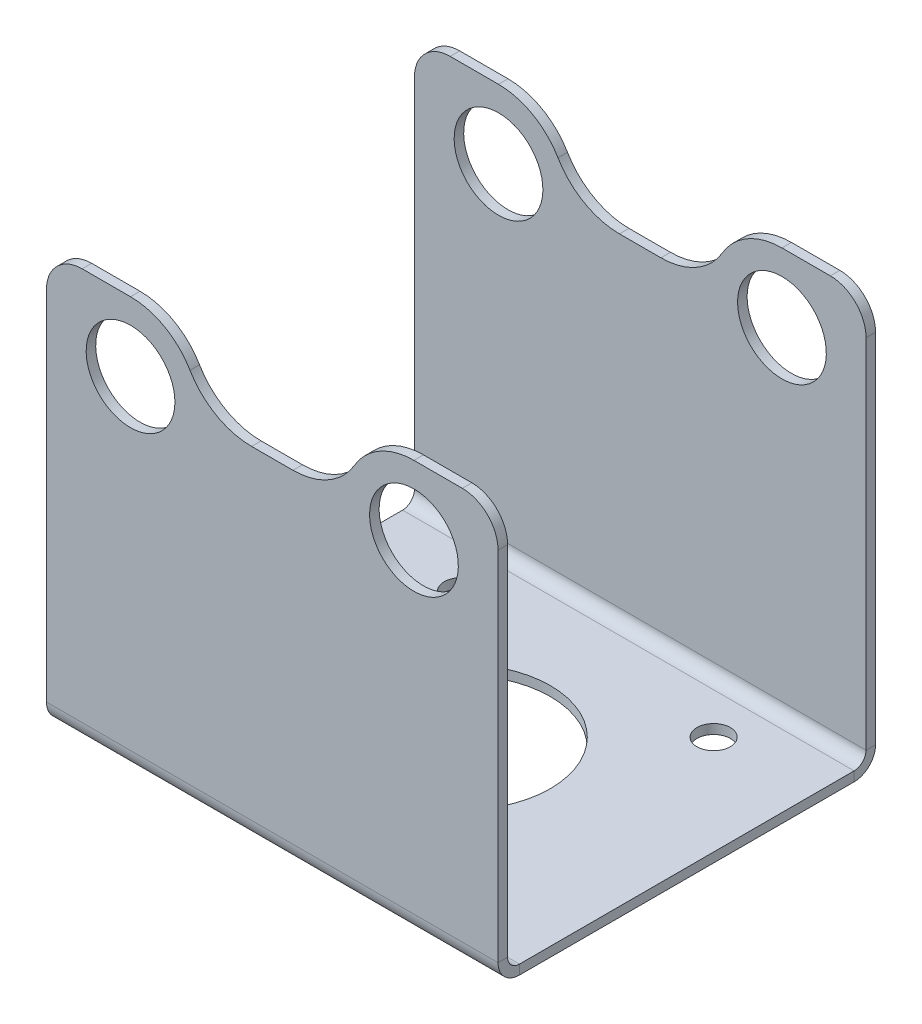
from build123d import *

# Parameters (mm, degrees)
SKETCH1_W                    = 48.1584
SKETCH1_H                    = 38.227
SKETCH1_R                    = 9.525
SKETCH1_R_2                  = 1.778
BASE_FLANGE1_DEPTH           = 1.016
EDGE_FLANGE1_STRIP_W         = 6.604
EDGE_FLANGE1_STRIP_H         = 1.016
EDGE_FLANGE1_STRIP_CUT_DEPTH = 48.1584
EDGE_FLANGE1_DEPTH           = 48.1584
EDGE_FLANGE1_START           = 1.016
EDGE_FLANGE1_PROFILE_W       = 48.1584
EDGE_FLANGE1_PROFILE_H       = 43.5102
EDGE_FLANGE1_PROFILE_R       = 4.73075
EDGE_FLANGE1_FLAT_DEPTH      = 1.016
CUT_EXTRUDE7_DEPTH           = 65.852611865
FILLET2_R                    = 7.62
FILLET3_R                    = 3.81


# Sheet-metal steps are written as plain solids
with BuildPart() as part:
    # Sketch1 → Base-Flange1 (new body)
    with BuildSketch(Plane(origin=(0, 0, 0), x_dir=(1, 0, 0), z_dir=(0, 1, 0))):
        Rectangle(SKETCH1_W, SKETCH1_H)
        with Locations(Location((0, 0, 0), (0, 0, 270))):
            Circle(SKETCH1_R, mode=Mode.SUBTRACT)
        with Locations(Location((13.470384182, -13.470384182, 0), (0, 0, 270))):
            Circle(SKETCH1_R_2, mode=Mode.SUBTRACT)
        with Locations(Location((13.470384182, 13.470384182, 0), (0, 0, 270))):
            Circle(SKETCH1_R_2, mode=Mode.SUBTRACT)
        with Locations(Location((-13.470384182, 13.470384182, 0), (0, 0, 90))):
            Circle(SKETCH1_R_2, mode=Mode.SUBTRACT)
        with Locations(Location((-13.470384182, -13.470384182, 0), (0, 0, 90))):
            Circle(SKETCH1_R_2, mode=Mode.SUBTRACT)
    extrude(amount=-BASE_FLANGE1_DEPTH)

    # Edge-Flange1 strip (across the edge) → Edge-Flange1 strip cut (cut)
    with BuildSketch(Plane(origin=(24.0792, 0, -19.1135), x_dir=(0, 0, 1), z_dir=(-1, 0, 0))):
        with Locations((-2.032, -0.508)):
            Rectangle(EDGE_FLANGE1_STRIP_W, EDGE_FLANGE1_STRIP_H)
    edge_flange1_strip_cut = extrude(amount=EDGE_FLANGE1_STRIP_CUT_DEPTH, mode=Mode.SUBTRACT)

    # Edge-Flange1 bend section (across the edge) → Edge-Flange1 (add)
    with BuildSketch(Plane(origin=(24.0792, 0, -19.1135), x_dir=(0, 0, 1), z_dir=(-1, 0, 0))):
        with BuildLine():
            Line((-1.016, 1.27), (0, 1.27))
            ThreePointArc((0, 1.27), (0.371974388, 0.371974388), (1.27, 0))
            Line((1.27, 0), (1.27, -1.016))
            ThreePointArc((1.27, -1.016), (-0.346446102, -0.346446102), (-1.016, 1.27))
        make_face()
    edge_flange1 = extrude(amount=EDGE_FLANGE1_DEPTH)

    # Edge-Flange1 profile (on flange) → Edge-Flange1 flat (add)
    with BuildSketch(Plane(origin=(0, 0, -19.1135), x_dir=(-1, 0, 0), z_dir=(0, 0, -1)).offset(EDGE_FLANGE1_START)):
        with Locations((0, 23.0251)):
            Rectangle(EDGE_FLANGE1_PROFILE_W, EDGE_FLANGE1_PROFILE_H)
        with Locations((-15.113, 35.814)):
            Circle(EDGE_FLANGE1_PROFILE_R, mode=Mode.SUBTRACT)
        with Locations((15.113, 35.814)):
            Circle(EDGE_FLANGE1_PROFILE_R, mode=Mode.SUBTRACT)
    edge_flange1_flat = extrude(amount=-EDGE_FLANGE1_FLAT_DEPTH)

    # Mirror1: Edge-Flange1 strip cut, Edge-Flange1, Edge-Flange1 flat across plane
    add(edge_flange1_strip_cut.mirror(Plane.XY), mode=Mode.SUBTRACT)
    add(edge_flange1.mirror(Plane.XY))
    add(edge_flange1_flat.mirror(Plane.XY))

    # Sketch11 → Cut-Extrude7 (cut, through all)
    with BuildSketch(Plane(origin=(0, 0, -20.1295), x_dir=(-1, 0, 0), z_dir=(0, 0, -1))):
        with BuildLine():
            Line((24.0792, 43.18), (24.0792, 44.7802))
            Line((24.0792, 44.7802), (-24.0792, 44.7802))
            Line((-24.0792, 44.7802), (-24.0792, 43.18))
            Line((-24.0792, 43.18), (-15.113, 43.18))
            ThreePointArc((-15.113, 43.18), (-9.90445145, 41.02254855), (-7.747, 35.814))
            Line((-7.747, 35.814), (7.747, 35.814))
            ThreePointArc((7.747, 35.814), (9.90445145, 41.02254855), (15.113, 43.18))
            Line((15.113, 43.18), (24.0792, 43.18))
        make_face()
    extrude(amount=-CUT_EXTRUDE7_DEPTH, mode=Mode.SUBTRACT)

    # Fillet2
    fillet2_edges = [part.edges().sort_by_distance(p)[0] for p in [
        (7.747, 35.814, -19.6215),
        (-7.747, 35.814, -19.6215),
        (7.747, 35.814, 19.6215),
        (-7.747, 35.814, 19.6215),
    ]]
    fillet(fillet2_edges, radius=FILLET2_R)

    # Fillet3
    fillet3_edges = [part.edges().sort_by_distance(p)[0] for p in [
        (-24.0792, 43.18, -19.6215),
        (24.0792, 43.18, -19.6215),
        (24.0792, 43.18, 19.6215),
        (-24.0792, 43.18, 19.6215),
    ]]
    fillet(fillet3_edges, radius=FILLET3_R)


solid = part.part
